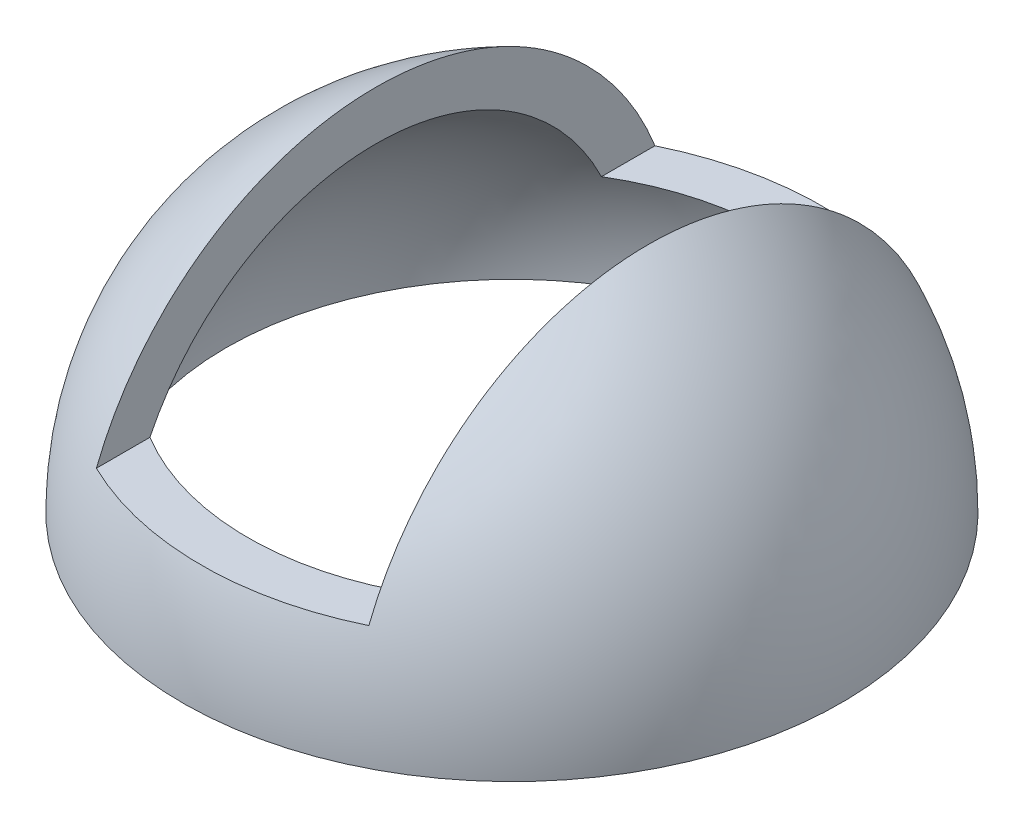
from build123d import *

# Parameters (mm, degrees)
SKETCH2_W          = 15.748
SKETCH2_H          = 16.418842622
CUT_EXTRUDE1_DEPTH = 63.5


with BuildPart() as part:
    # Sketch1 → Revolve1 (revolve)
    with BuildSketch(Plane.XY):
        with BuildLine():
            Line((19.05, 0), (16.51, 0))
            ThreePointArc((16.51, 0), (11.674332957, 11.674332957), (0, 16.51))
            Line((0, 16.51), (0, 19.05))
            ThreePointArc((0, 19.05), (13.470384182, 13.470384182), (19.05, 0))
        make_face()
    revolve(axis=Axis((0, 19.05, 0), (0, -1, 0)))

    # Sketch2 → Cut-Extrude1 (cut, symmetric)
    with BuildSketch(Plane.XY):
        with Locations((0, 14.559421311)):
            Rectangle(SKETCH2_W, SKETCH2_H)
    extrude(amount=CUT_EXTRUDE1_DEPTH, both=True, mode=Mode.SUBTRACT)


solid = part.part
